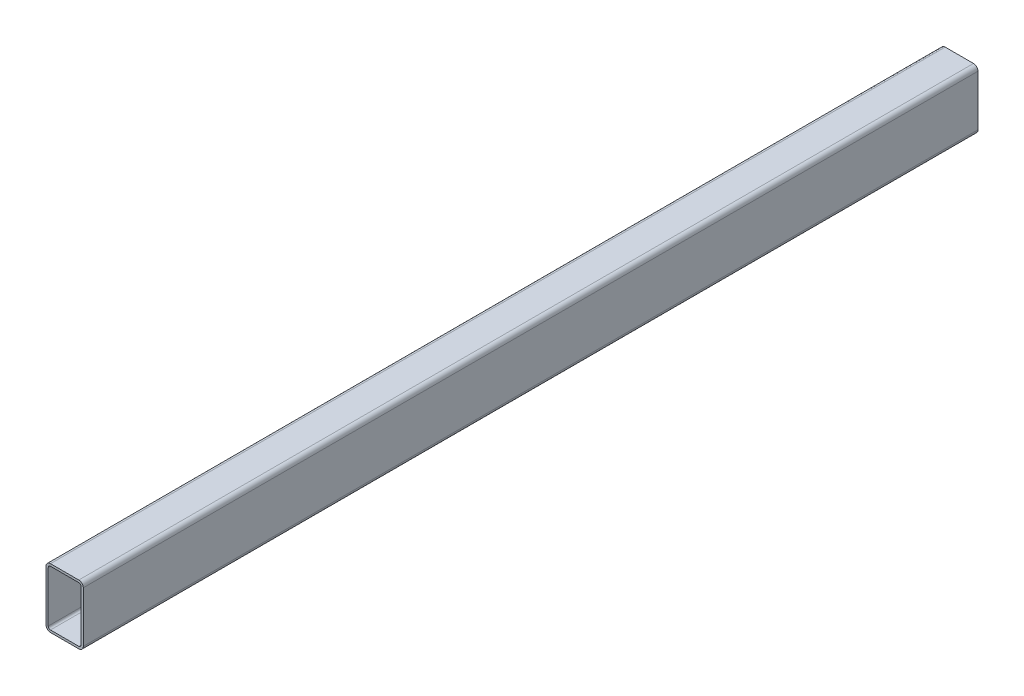
from build123d import *

# Parameters (mm, degrees)
BOSS_EXTRUDE1_DEPTH = 600


with BuildPart() as part:
    # Sketch1 → Boss-Extrude1 (new, symmetric)
    with BuildSketch(Plane.XY):
        with BuildLine():
            Line((19, -40), (-19, -40))
            ThreePointArc((-19, -40), (-23.242640687, -38.242640687), (-25, -34))
            Line((-25, -34), (-25, 34))
            ThreePointArc((-25, 34), (-23.242640687, 38.242640687), (-19, 40))
            Line((-19, 40), (19, 40))
            ThreePointArc((19, 40), (23.242640687, 38.242640687), (25, 34))
            Line((25, 34), (25, -34))
            ThreePointArc((25, -34), (23.242640687, -38.242640687), (19, -40))
        make_face()
        with BuildLine():
            Line((19, 37), (-19, 37))
            ThreePointArc((-19, 37), (-21.121320344, 36.121320344), (-22, 34))
            Line((-22, 34), (-22, -34))
            ThreePointArc((-22, -34), (-21.121320344, -36.121320344), (-19, -37))
            Line((-19, -37), (19, -37))
            ThreePointArc((19, -37), (21.121320344, -36.121320344), (22, -34))
            Line((22, -34), (22, 34))
            ThreePointArc((22, 34), (21.121320344, 36.121320344), (19, 37))
        make_face(mode=Mode.SUBTRACT)
    extrude(amount=BOSS_EXTRUDE1_DEPTH, both=True)


solid = part.part
